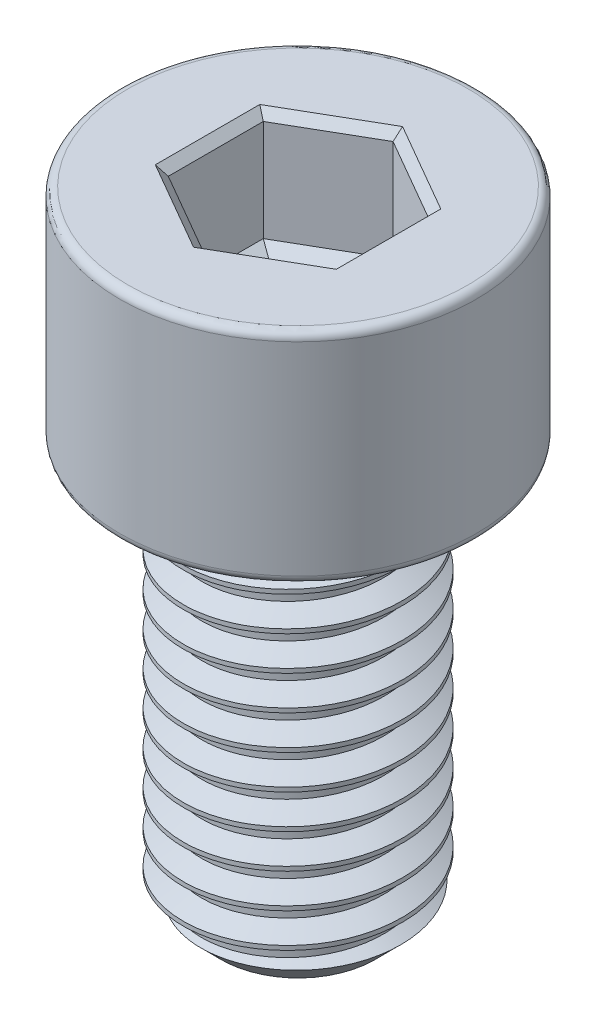
from build123d import *

# Parameters (mm, degrees)
SKETCH1_R           = 4
BOSS_EXTRUDE1_DEPTH = 15
THREAD1_PITCH       = 1.25
SKETCH2_R           = 6.5
BOSS_EXTRUDE2_DEPTH = 8
FILLET1_R           = 0.3
CUT_EXTRUDE1_DEPTH  = 4
CHAMFER1_SIZE       = 0.3
CUT_EXTRUDE2_DEPTH  = 0.4
CUT_EXTRUDE2_DRAFT  = -60


with BuildPart() as part:
    # Sketch1 → Boss-Extrude1 (new body)
    with BuildSketch(Plane(origin=(0, 0, 0), x_dir=(1, 0, 0), z_dir=(0, 1, 0))):
        with Locations(Location((0, 0, 0), (0, 0, 270))):
            Circle(SKETCH1_R)
    extrude(amount=BOSS_EXTRUDE1_DEPTH)

    # Thread1: the profile of Thread Profile1 profile screwed along a right-hand helix of 13 turns, 8 arcs to a turn; built about Z, then put on its axis
    thread1_z = Axis((0, 0, 0), (0, 0, 1))
    thread1_corners = [(4.0003, 0, -0.000173205), (4.0003, 0, 1.093923202), (3.323417656, 0, 0.703124998), (3.323417656, 0, 0.390624998)]
    with BuildLine(mode=Mode.PRIVATE) as thread1_profile:
        Line(thread1_corners[0], thread1_corners[1])
        Line(thread1_corners[1], thread1_corners[2])
        Line(thread1_corners[2], thread1_corners[3])
        Line(thread1_corners[3], thread1_corners[0])
    thread1_cap = Face(thread1_profile.wire())
    thread1_turn_angles = [0, 22.5, 45, 67.5, 90, 112.5, 135, 157.5, 180, 202.5, 225, 247.5, 270, 292.5, 315, 337.5, 360]
    thread1_turn_weights = [1, 0.9238795325112867, 1, 0.9238795325112867, 1, 0.9238795325112867, 1, 0.9238795325112867, 1, 0.9238795325112867, 1, 0.9238795325112867, 1, 0.9238795325112867, 1, 0.9238795325112867, 1]
    thread1_turn_rails = [Edge.make_bspline([Vector(p[0], p[1], 0).rotate(thread1_z, thread1_turn_angles[k]) / thread1_turn_weights[k] + Vector(0, 0, p[2] + THREAD1_PITCH * thread1_turn_angles[k] / 360) for k in range(17)], [0, 0, 0, 1, 1, 2, 2, 3, 3, 4, 4, 5, 5, 6, 6, 7, 7, 8, 8, 8], 2, thread1_turn_weights) for p in thread1_corners]
    thread1_turn_sides = [Face.make_surface_from_curves(thread1_turn_rails[p[0]], thread1_turn_rails[p[1]]) for p in [(0, 1), (1, 2), (2, 3), (3, 0)]]
    thread1 = Plane(origin=(0, 16.25, 0), x_dir=(-1, 0, 0), z_dir=(0, -1, 0)) * Solid(Shell([*[p.moved(Location((0, 0, THREAD1_PITCH * i))) for i in range(13) for p in thread1_turn_sides], thread1_cap, thread1_cap.rotate(thread1_z, 4680).moved(Location((0, 0, THREAD1_PITCH * 4680 / 360)))]))
    add(thread1, mode=Mode.SUBTRACT)

    # Sketch2 → Boss-Extrude2 (add)
    with BuildSketch(Plane(origin=(0, 15, 0), x_dir=(1, 0, 0), z_dir=(0, 1, 0))):
        with Locations(Location((0, 0, 0), (0, 0, 270))):
            Circle(SKETCH2_R)
    extrude(amount=BOSS_EXTRUDE2_DEPTH)

    # Sketch5 → Cut-Revolve1 (revolve, cut)
    with BuildSketch(Plane.XY, mode=Mode.PRIVATE) as cut_revolve1_sk:
        Polygon((4.01, 0), (4.01, 1.2), (2.81, 0), align=None)
    revolve(cut_revolve1_sk.sketch.rotate(Axis((0, 0, 0), (0, 1, 0)), 170.138426735), axis=Axis((0, 0, 0), (0, 1, 0)), mode=Mode.SUBTRACT)

    # Fillet1
    fillet1_edges = [part.edges().sort_by_distance(p)[0] for p in [
        (0, 15, -6.5),
        (0, 23, -6.5),
    ]]
    fillet(fillet1_edges, radius=FILLET1_R)

    # Sketch6 → Cut-Extrude1 (cut)
    with BuildSketch(Plane(origin=(0, 23, 0), x_dir=(1, 0, 0), z_dir=(0, 1, 0))):
        Polygon((0, 3.464101615), (-3, 1.732050808), (-3, -1.732050808), (0, -3.464101615), (3, -1.732050808), (3, 1.732050808), align=None)
    extrude(amount=-CUT_EXTRUDE1_DEPTH, mode=Mode.SUBTRACT)

    # Chamfer1
    chamfer1_edges = [part.edges().sort_by_distance(p)[0] for p in [
        (1.5, 23, -2.598076211),
        (-1.5, 23, -2.598076211),
        (-3, 23, 0),
        (-1.5, 23, 2.598076211),
        (1.5, 23, 2.598076211),
        (3, 23, 0),
    ]]
    chamfer(chamfer1_edges, length=CHAMFER1_SIZE)


with BuildPart() as cut_extrude2_tool:
    # Sketch7 → Cut-Extrude2 (with draft: the straight prism first)
    with BuildSketch(Plane(origin=(0, 19, 0), x_dir=(1, 0, 0), z_dir=(0, 1, 0))):
        Polygon((0, 3.464101615), (-3, 1.732050808), (-3, -1.732050808), (0, -3.464101615), (3, -1.732050808), (3, 1.732050808), align=None)
    extrude(amount=-CUT_EXTRUDE2_DEPTH)
    # Cut-Extrude2: the draft: its side faces are tilted about the plane it starts from
    cut_extrude2_sides = [cut_extrude2_tool.faces().sort_by_distance(p)[0] for p in [
        (-1.5, 18.8, -2.598076211),
        (-3, 18.8, 0),
        (-1.5, 18.8, 2.598076211),
        (1.5, 18.8, 2.598076211),
        (3, 18.8, 0),
        (1.5, 18.8, -2.598076211),
    ]]
    draft(cut_extrude2_sides, Plane(origin=(0, 19, 0), x_dir=(1, 0, 0), z_dir=(0, 1, 0)), CUT_EXTRUDE2_DRAFT)


with BuildPart() as part_1:
    add(part.part)

    # Cut-Extrude2: cut by cut_extrude2_tool
    add(cut_extrude2_tool.part, mode=Mode.SUBTRACT)


solid = part_1.part
